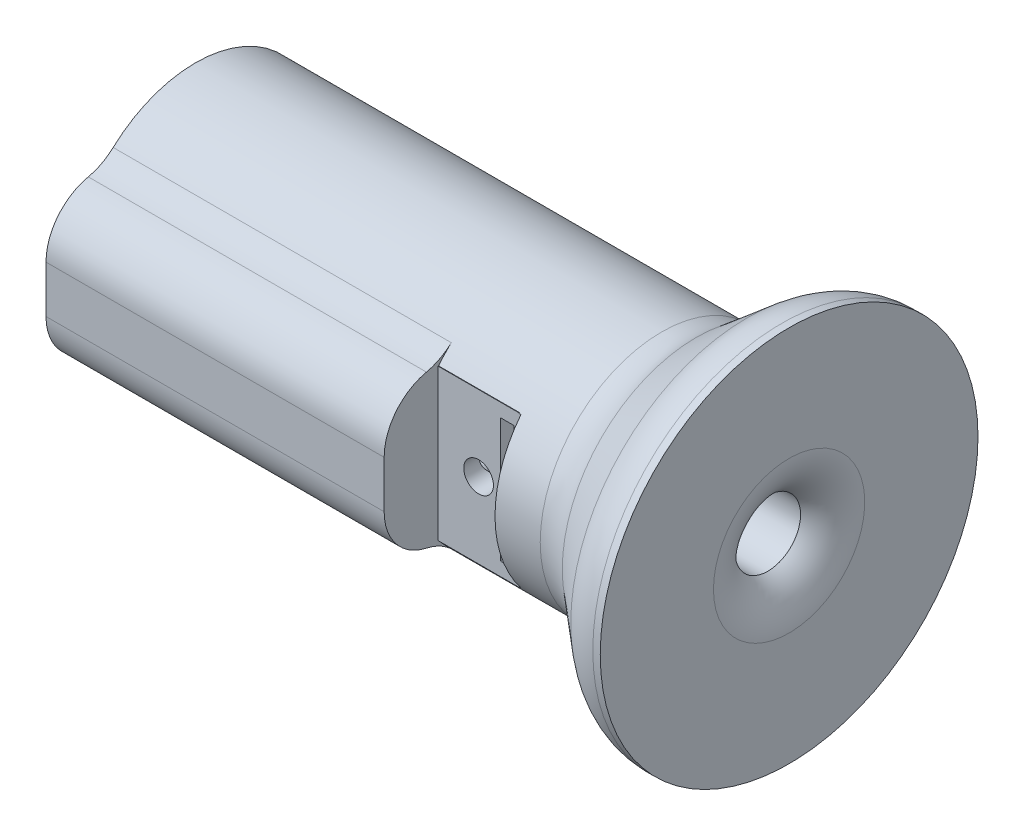
from build123d import *

# Parameters (mm, degrees)
SCHIZZO3_W                             = 9.243109639
SCHIZZO3_H                             = 30.902871456
TAGLIO_ESTRUSIONE2_DEPTH               = 78
SCHIZZO4_W                             = 15
SCHIZZO4_H                             = 28
ESTRUSIONE_ESTRUSIONE1_DEPTH           = 12
FORO_PER_VITE_M4_2_D                   = 37
FORO_PER_VITE_M4_2_DEPTH               = 60
FORO_PER_VITE_M5_1_D                   = 5.5
FORO_PER_VITE_M5_1_DEPTH               = 10
FORO_PER_VITE_M5_2_D                   = 5.5
FORO_PER_VITE_M5_2_DEPTH               = 10
FORO_PER_VITE_M2_2_D                   = 2.4
FORO_PER_VITE_M2_2_DEPTH               = 4
FORO_PER_VITE_M2_2_TIP                 = 0.721032743
SCHIZZO28_W                            = 62.660258955
SCHIZZO28_H                            = 27.779148216
ESTRUSIONE_ESTRUSIONE7_DEPTH           = 10
SCHIZZO29_W                            = 8.847921359
SCHIZZO29_H                            = 10.755513732
TAGLIO_ESTRUSIONE5_DEPTH               = 60
RACCORDO20_R                           = 10
RACCORDO21_R                           = 10
RACCORDO22_R                           = 10
RACCORDO24_R                           = 10
RACCORDO25_R                           = 10
RACCORDO26_R                           = 10
RACCORDO27_R                           = 10
SCHIZZO30_R                            = 6.061580104
TAGLIO_ESTRUSIONE6_DEPTH               = 23
SCHIZZO31_W                            = 2.5
SCHIZZO31_H                            = 23
TAGLIO_ESTRUSIONE7_DEPTH               = 23.75
FORO_SVASATO_PER_VITE_M3_1_D           = 3.4
FORO_SVASATO_PER_VITE_M3_1_CSINK_D     = 6.3
FORO_SVASATO_PER_VITE_M3_1_CSINK_ANGLE = 90


with BuildPart() as part:
    # Schizzo2 → Rivoluzione2 (revolve)
    with BuildSketch(Plane(origin=(0, 0, 0), x_dir=(1, 0, 0), z_dir=(0, 1, 0)), mode=Mode.PRIVATE) as rivoluzione2_sk:
        Polygon((-91.723538337, 22.5), (-91.723538337, 0), (14.335392963, 0), (14.335392963, 6.061580104), (18.276461663, 6.061580104), (18.276461663, 35), (13.276461663, 35), (-1.723538337, 22.5), align=None)
    revolve(rivoluzione2_sk.sketch.rotate(Axis((-119.689698016, 0, 0), (1, 0, 0)), 180), axis=Axis((-119.689698016, 0, 0), (1, 0, 0)))

    # Schizzo3 → Taglio-Estrusione2 (cut)
    with BuildSketch(Plane.ZY.offset(91.723538337)):
        with Locations((22.322677132, 0)):
            Rectangle(SCHIZZO3_W, SCHIZZO3_H)
    extrude(amount=-TAGLIO_ESTRUSIONE2_DEPTH, mode=Mode.SUBTRACT)

    # Schizzo4 → Estrusione-Estrusione1 (add)
    with BuildSketch(Plane.XY.offset(17.701122312)):
        with Locations((-21.563279382, 0)):
            Rectangle(SCHIZZO4_W, SCHIZZO4_H)
    extrude(amount=-ESTRUSIONE_ESTRUSIONE1_DEPTH)

    # Foro per Vite M4-2
    with Locations(Plane.ZY.offset(91.723538337)):
        with Locations((0, 0)):
            Hole(FORO_PER_VITE_M4_2_D / 2, depth=FORO_PER_VITE_M4_2_DEPTH)

    # Foro per Vite M5-1
    with Locations(Plane.XY.offset(17.701122312)):
        with Locations((-21.563279382, 0)):
            Hole(FORO_PER_VITE_M5_1_D / 2, depth=FORO_PER_VITE_M5_1_DEPTH)

    # Foro per Vite M5-2
    with Locations(Plane.ZY.offset(31.723538337)):
        with Locations((12.047310847, 0)):
            Hole(FORO_PER_VITE_M5_2_D / 2, depth=FORO_PER_VITE_M5_2_DEPTH)

    # Foro per Vite M2-2
    with Locations(Plane.ZY.offset(91.723538337)):
        with Locations((0, 20.2), (0, -20.2)):
            Hole(FORO_PER_VITE_M2_2_D / 2, depth=FORO_PER_VITE_M2_2_DEPTH)
            with Locations((0, 0, -(FORO_PER_VITE_M2_2_DEPTH + FORO_PER_VITE_M2_2_TIP / 2))):  # 118° drill point
                Cone(0, FORO_PER_VITE_M2_2_D / 2, FORO_PER_VITE_M2_2_TIP, mode=Mode.SUBTRACT)

    # Schizzo28 → Estrusione-Estrusione7 (add)
    with BuildSketch(Plane.XY.offset(17.701122312)):
        with Locations((-60.39340886, 0)):
            Rectangle(SCHIZZO28_W, SCHIZZO28_H)
    extrude(amount=ESTRUSIONE_ESTRUSIONE7_DEPTH)

    # Schizzo29 → Taglio-Estrusione5 (cut)
    with BuildSketch(Plane.ZY.offset(91.723538337)):
        with Locations((22.125082992, 0)):
            Rectangle(SCHIZZO29_W, SCHIZZO29_H)
    extrude(amount=-TAGLIO_ESTRUSIONE5_DEPTH, mode=Mode.SUBTRACT)

    # Raccordo20
    # the kernel refuses this fillet: 10 mm, written as the material it takes off along each edge
    with BuildSketch(Plane(origin=(18.276461663, 0, 0), x_dir=(0, 0, 1), z_dir=(0, 1, 0))) as raccordo20_piece_1:
        with BuildLine():
            CenterArc((14.017040588, -10), RACCORDO20_R, 90, 52.706861747)
            Line((6.061580104, -3.9410687), (5.902470894, -3.819890074))
            ThreePointArc((5.902470894, -3.819890074), (5.861580104, -1.97053435), (5.861580104, 0))
            Line((5.861580104, 0), (6.061580104, 0.2))
            Line((6.061580104, 0.2), (14.017040588, 0.2))
            Line((14.017040588, 0.2), (14.017040588, 0))
        make_face()
    revolve(axis=Axis((18.276461663, 0, 0), (1, 0, 0)), mode=Mode.SUBTRACT)

    # Raccordo21
    raccordo21_edges = [part.edges().sort_by_distance(p)[0] for p in [
        (13.276461663, 0, -35),
    ]]
    fillet(raccordo21_edges, radius=RACCORDO21_R)

    # Raccordo22
    raccordo22_edges = [part.edges().sort_by_distance(p)[0] for p in [
        (-1.723538337, 0, -22.5),
    ]]
    fillet(raccordo22_edges, radius=RACCORDO22_R)

    # Raccordo24
    # the kernel refuses this fillet: 10 mm, written as the material it adds along each edge
    with BuildSketch(Plane(origin=(-29.063279382, 13.889574108, 17.701122312), x_dir=(0, 0.7347199128018105, -0.6783705843655811), z_dir=(-1, 0, 0))) as raccordo24_piece_1:
        with BuildLine():
            CenterArc((4.407269799, -9.967842465), RACCORDO24_R, 94.596163378, 42.687391022)
            Line((-2.939929329, -3.184136621), (0, 0))
            ThreePointArc((0, 0), (1.802974009, -0.072354454), (3.605948017, 0))
        make_face()
    extrude(amount=62.660258955)

    # Raccordo25
    raccordo25_edges = [part.edges().sort_by_distance(p)[0] for p in [
        (-60.393408859, 13.889574108, 27.701122312),
    ]]
    fillet(raccordo25_edges, radius=RACCORDO25_R)

    # Raccordo26
    # the kernel refuses this fillet: 10 mm, written as the material it adds along each edge
    with BuildSketch(Plane(origin=(-29.063279382, -13.889574108, 17.701122312), x_dir=(0, -0.7347199128018104, -0.6783705843655813), z_dir=(-1, 0, 0))) as raccordo26_piece_1:
        with BuildLine():
            CenterArc((4.407269799, 9.967842465), RACCORDO26_R, 222.7164456, 42.687391022)
            Line((-2.939929329, 3.184136621), (0, 0))
            ThreePointArc((0, 0), (1.802974009, 0.072354454), (3.605948017, 0))
        make_face()
    extrude(amount=62.660258955)

    # Raccordo27
    raccordo27_edges = [part.edges().sort_by_distance(p)[0] for p in [
        (-60.393408859, -13.889574108, 27.701122312),
    ]]
    fillet(raccordo27_edges, radius=RACCORDO27_R)

    # Schizzo30 → Taglio-Estrusione6 (cut)
    with BuildSketch(Plane(origin=(14.335392963, 0, 0), x_dir=(0, 0, -1), z_dir=(1, 0, 0))):
        Circle(SCHIZZO30_R)
    extrude(amount=-TAGLIO_ESTRUSIONE6_DEPTH, mode=Mode.SUBTRACT)

    # Schizzo31 → Taglio-Estrusione7 (cut)
    with BuildSketch(Plane.XY.offset(17.701122312)):
        with Locations((-16.268538337, 0)):
            Rectangle(SCHIZZO31_W, SCHIZZO31_H)
    extrude(amount=-TAGLIO_ESTRUSIONE7_DEPTH, mode=Mode.SUBTRACT)

    # Foro svasato per Vite M3-1 (through all)
    with Locations(Plane(origin=(-8.664607037, 0, 0), x_dir=(0, 0, -1), z_dir=(1, 0, 0))):
        with Locations((0, 0)):
            CounterSinkHole(FORO_SVASATO_PER_VITE_M3_1_D / 2, FORO_SVASATO_PER_VITE_M3_1_CSINK_D / 2, counter_sink_angle=FORO_SVASATO_PER_VITE_M3_1_CSINK_ANGLE)


solid = part.part
